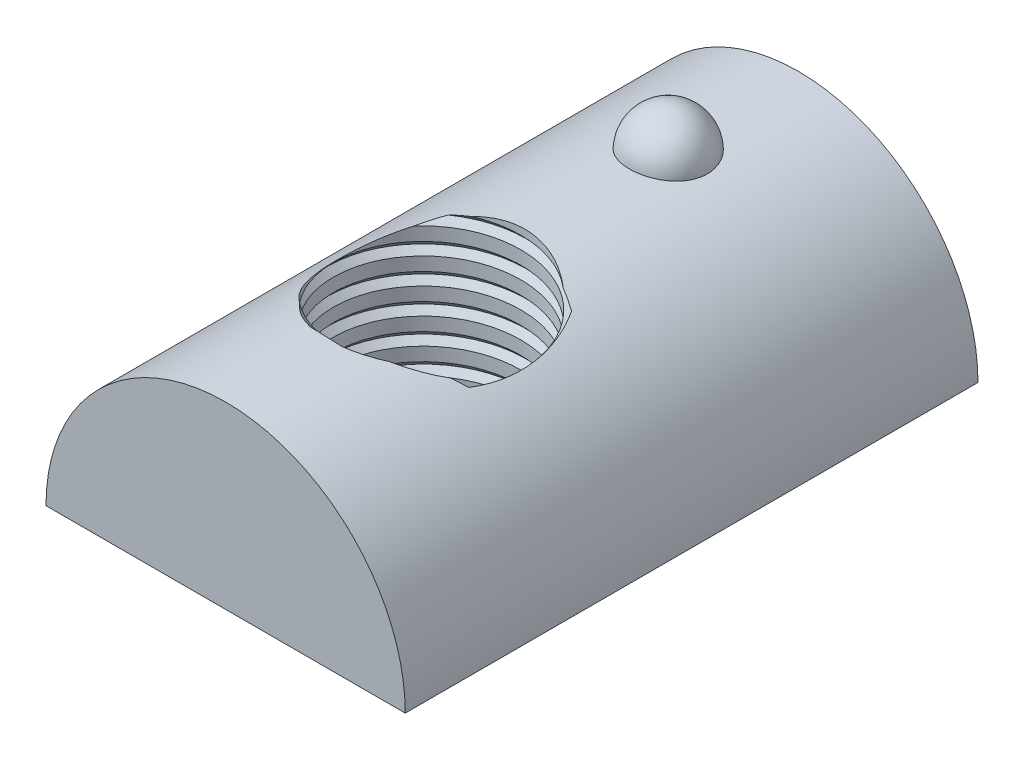
from build123d import *

# Parameters (mm, degrees)
EXTRUDE_1_DEPTH     = 22
SKETCH_2_R          = 3.6
CUT_EXTRUDE_1_DEPTH = 27.870988073
SWEEP_1_PITCH       = 1


with BuildPart() as part:
    # 草图1 → 凸台-拉伸1 (new body)
    with BuildSketch(Plane.XY):
        with BuildLine():
            Line((0, 0), (13.8, 0))
            ThreePointArc((13.8, 0), (6.9, 6.9), (0, 0))
        make_face()
    extrude(amount=EXTRUDE_1_DEPTH)

    # 草图2 → 切除-拉伸1 (cut, through all)
    with BuildSketch(Plane.XZ):
        with Locations(Location((6.9, 14.1, 0), (0, 0, 270))):
            Circle(SKETCH_2_R)
    extrude(amount=-CUT_EXTRUDE_1_DEPTH, mode=Mode.SUBTRACT)

    # 切除-扫描1: arcs per turn and ends read off the stored shape
    # 切除-扫描1: the profile of 草图5 profile screwed along a right-hand helix through 7 turns, 8 arcs to a turn; built about Z, then put on its axis
    sweep_1_z = Axis((0, 0, 0), (0, 0, 1))
    sweep_1_corners = [(3.5997, 0, 0.242147826), (3.5997, 0, -0.242147836), (3.828579457, 0, -5e-09)]
    with BuildLine(mode=Mode.PRIVATE) as sweep_1_profile:
        Line(sweep_1_corners[0], sweep_1_corners[1])
        Line(sweep_1_corners[1], sweep_1_corners[2])
        Line(sweep_1_corners[2], sweep_1_corners[0])
    sweep_1_cap = Face(sweep_1_profile.wire())
    sweep_1_turn_angles = [0, 22.5, 45, 67.5, 90, 112.5, 135, 157.5, 180, 202.5, 225, 247.5, 270, 292.5, 315, 337.5, 360]
    sweep_1_turn_weights = [1, 0.9238795325112867, 1, 0.9238795325112867, 1, 0.9238795325112867, 1, 0.9238795325112867, 1, 0.9238795325112867, 1, 0.9238795325112867, 1, 0.9238795325112867, 1, 0.9238795325112867, 1]
    sweep_1_turn_rails = [Edge.make_bspline([Vector(p[0], p[1], 0).rotate(sweep_1_z, sweep_1_turn_angles[k]) / sweep_1_turn_weights[k] + Vector(0, 0, p[2] + SWEEP_1_PITCH * sweep_1_turn_angles[k] / 360) for k in range(17)], [0, 0, 0, 1, 1, 2, 2, 3, 3, 4, 4, 5, 5, 6, 6, 7, 7, 8, 8, 8], 2, sweep_1_turn_weights) for p in sweep_1_corners]
    sweep_1_turn_sides = [Face.make_surface_from_curves(sweep_1_turn_rails[p[0]], sweep_1_turn_rails[p[1]]) for p in [(0, 1), (1, 2), (2, 0)]]
    sweep_1 = Plane(origin=(6.9, 0, 14.1), x_dir=(0.7071067811865437, 0, 0.7071067811865515), z_dir=(0, 1, 0)) * Solid(Shell([*[p.moved(Location((0, 0, SWEEP_1_PITCH * i))) for i in range(7) for p in sweep_1_turn_sides], sweep_1_cap, sweep_1_cap.rotate(sweep_1_z, 2520).moved(Location((0, 0, SWEEP_1_PITCH * 2520 / 360)))]))
    add(sweep_1, mode=Mode.SUBTRACT)

    # 草图7 → 旋转6 (revolve)
    with BuildSketch(Plane(origin=(0, 0, 5), x_dir=(-1, 0, 0), z_dir=(0, 0, -1))):
        with BuildLine():
            Line((-6.9, 8.272077256), (-6.9, 5.272077256))
            ThreePointArc((-6.9, 5.272077256), (-5.4, 6.772077256), (-6.9, 8.272077256))
        make_face()
    revolve(axis=Axis((6.9, 8.272077256, 5), (0, -1, 0)))


solid = part.part
